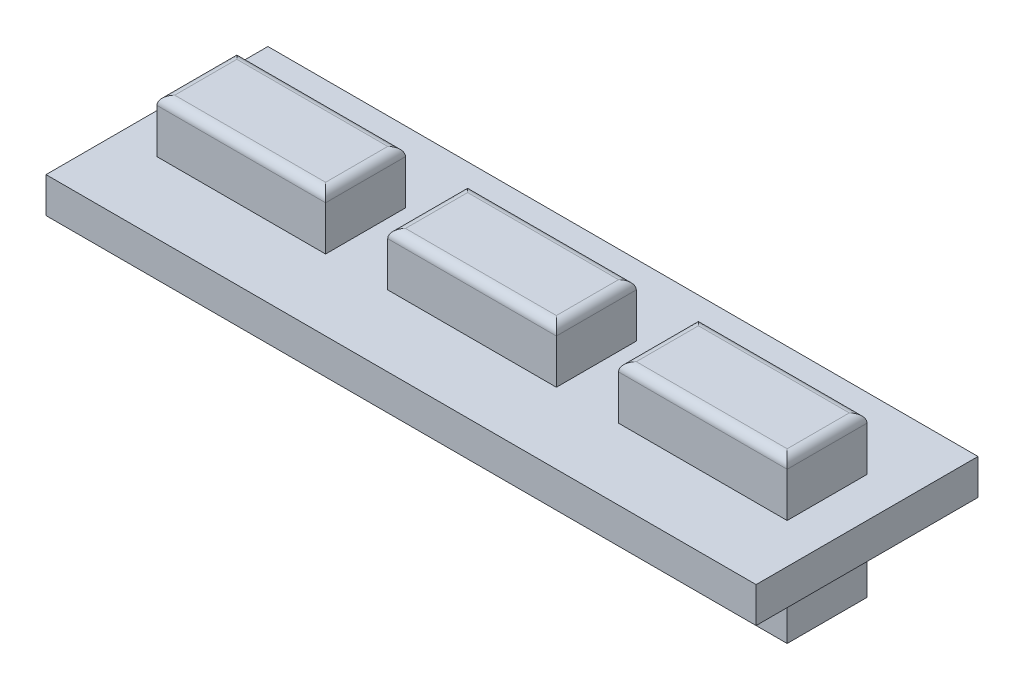
from build123d import *

# Parameters (mm, degrees)
BOSS_EXTRUDE1_DEPTH        = 2.032
BOSS_EXTRUDE1_DEPTH_BACK   = 2.54
SKETCH1_W                  = 4.826
SKETCH1_H                  = 2.286
BOSS_EXTRUDE1_2_DEPTH      = 2.032
BOSS_EXTRUDE1_2_DEPTH_BACK = 2.54
BOSS_EXTRUDE1_3_DEPTH      = 2.032
BOSS_EXTRUDE1_3_DEPTH_BACK = 2.54
BOSS_EXTRUDE2_DEPTH        = 0.508
BOSS_EXTRUDE2_DEPTH_BACK   = 0.508
SKETCH1_3_W                = 20.32
SKETCH1_3_H                = 6.35
FILLET1_R                  = 0.254


with BuildPart() as part:
    # Sketch1 → Boss-Extrude1 (new, two sides: drawn at the far end of the back side and taken through both)
    with BuildSketch(Plane(origin=(0, 3.048, 0), x_dir=(1, 0, 0), z_dir=(0, 1, 0)).offset(-BOSS_EXTRUDE1_DEPTH_BACK)):
        with Locations((-6.594695904, 25.584471791)):
            Rectangle(SKETCH1_W, SKETCH1_H)
    extrude(amount=BOSS_EXTRUDE1_DEPTH + BOSS_EXTRUDE1_DEPTH_BACK)



with BuildPart() as body_2:
    # Sketch1 → Boss-Extrude1 2 (new, two sides: drawn at the far end of the back side and taken through both)
    with BuildSketch(Plane(origin=(0, 3.048, 0), x_dir=(1, 0, 0), z_dir=(0, 1, 0)).offset(-BOSS_EXTRUDE1_2_DEPTH_BACK)):
        with Locations((0.009304096, 25.584471791)):
            Rectangle(SKETCH1_W, SKETCH1_H)
    extrude(amount=BOSS_EXTRUDE1_2_DEPTH + BOSS_EXTRUDE1_2_DEPTH_BACK)


with BuildPart() as body_3:
    # Sketch1 → Boss-Extrude1 3 (new, two sides: drawn at the far end of the back side and taken through both)
    with BuildSketch(Plane(origin=(0, 3.048, 0), x_dir=(1, 0, 0), z_dir=(0, 1, 0)).offset(-BOSS_EXTRUDE1_3_DEPTH_BACK)):
        with Locations((6.613304096, 25.584471791)):
            Rectangle(SKETCH1_W, SKETCH1_H)
    extrude(amount=BOSS_EXTRUDE1_3_DEPTH + BOSS_EXTRUDE1_3_DEPTH_BACK)


with BuildPart() as part_1:
    add(part.part)

    add(body_2.part)  # Boss-Extrude2 merges body 2

    add(body_3.part)  # Boss-Extrude2 merges body 3
    # Sketch1<3> → Boss-Extrude2 (add, two sides: drawn at the far end of the back side and taken through both)
    with BuildSketch(Plane(origin=(0, 3.048, 0), x_dir=(1, 0, 0), z_dir=(0, 1, 0)).offset(-BOSS_EXTRUDE2_DEPTH_BACK)):
        with Locations((0.009304096, 25.584471791)):
            Rectangle(SKETCH1_3_W, SKETCH1_3_H)
    extrude(amount=BOSS_EXTRUDE2_DEPTH + BOSS_EXTRUDE2_DEPTH_BACK)

    # Fillet1
    fillet1_edges = [part_1.edges().sort_by_distance(p)[0] for p in [
        (0.009304096, 5.08, -24.441471791),
        (-2.403695904, 5.08, -25.584471791),
        (0.009304096, 5.08, -26.727471791),
        (2.422304096, 5.08, -25.584471791),
        (-6.594695904, 5.08, -24.441471791),
        (-9.007695904, 5.08, -25.584471791),
        (-6.594695904, 5.08, -26.727471791),
        (-4.181695904, 5.08, -25.584471791),
        (6.613304096, 5.08, -24.441471791),
        (4.200304096, 5.08, -25.584471791),
        (6.613304096, 5.08, -26.727471791),
        (9.026304096, 5.08, -25.584471791),
    ]]
    fillet(fillet1_edges, radius=FILLET1_R)


solid = part_1.part
